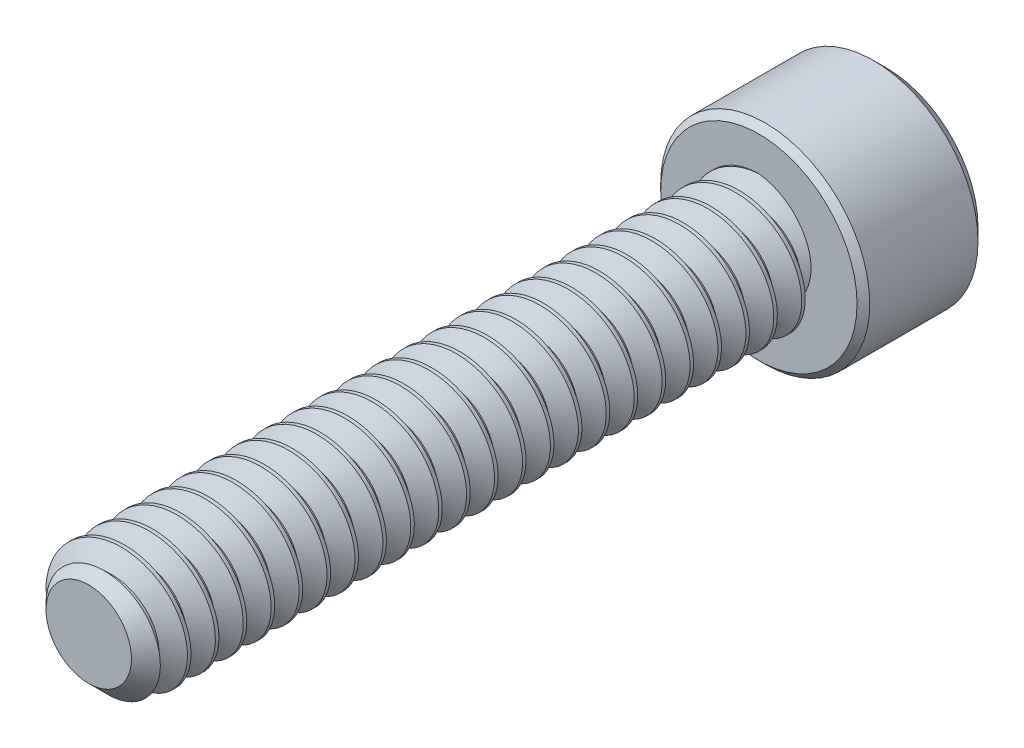
from build123d import *

# Parameters (mm, degrees)
SKETCH1_R          = 2.413
EXTRUDE1_DEPTH     = 25.4
CHAMFER3_SIZE      = 0.79375
CUT_SWEEP1_PITCH   = 1.058333333
SKETCH6_R          = 3.9624
EXTRUDE2_DEPTH     = 4.826
CUT_EXTRUDE1_DEPTH = 2.9765625
SKETCH8_R          = 2.291358881
CUT_EXTRUDE2_DEPTH = 0.4826
CUT_EXTRUDE2_DRAFT = -45
CHAMFER1_SIZE      = 0.4826
CHAMFER2_SIZE      = 0.2413


with BuildPart() as part:
    # Sketch1 → Extrude1 (new body)
    with BuildSketch(Plane.XY):
        Circle(SKETCH1_R)
    extrude(amount=-EXTRUDE1_DEPTH)

    # Chamfer3
    chamfer3_edges = [part.edges().sort_by_distance(p)[0] for p in [
        (-2.413, 0, 0),
    ]]
    chamfer(chamfer3_edges, length=CHAMFER3_SIZE)

    # Cut-Sweep1: the profile of Sketch3 profile screwed along a right-hand helix of 25 turns, 6 arcs to a turn; built about Z, then put on its axis
    cut_sweep1_z = Axis((0, 0, 0), (0, 0, 1))
    cut_sweep1_corners = [(2.4133, 0, -0.926214872), (1.725592336, 0, -0.529166667), (1.725592336, 0, -0.396875), (2.4133, 0, 0.000173205)]
    with BuildLine(mode=Mode.PRIVATE) as cut_sweep1_profile:
        Line(cut_sweep1_corners[0], cut_sweep1_corners[1])
        Line(cut_sweep1_corners[1], cut_sweep1_corners[2])
        Line(cut_sweep1_corners[2], cut_sweep1_corners[3])
        Line(cut_sweep1_corners[3], cut_sweep1_corners[0])
    cut_sweep1_cap = Face(cut_sweep1_profile.wire())
    cut_sweep1_turn_angles = [0, 30, 60, 90, 120, 150, 180, 210, 240, 270, 300, 330, 360]
    cut_sweep1_turn_weights = [1, 0.8660254037844387, 1, 0.8660254037844387, 1, 0.8660254037844387, 1, 0.8660254037844387, 1, 0.8660254037844387, 1, 0.8660254037844387, 1]
    cut_sweep1_turn_rails = [Edge.make_bspline([Vector(p[0], p[1], 0).rotate(cut_sweep1_z, cut_sweep1_turn_angles[k]) / cut_sweep1_turn_weights[k] + Vector(0, 0, p[2] + CUT_SWEEP1_PITCH * cut_sweep1_turn_angles[k] / 360) for k in range(13)], [0, 0, 0, 1, 1, 2, 2, 3, 3, 4, 4, 5, 5, 6, 6, 6], 2, cut_sweep1_turn_weights) for p in cut_sweep1_corners]
    cut_sweep1_turn_sides = [Face.make_surface_from_curves(cut_sweep1_turn_rails[p[0]], cut_sweep1_turn_rails[p[1]]) for p in [(0, 1), (1, 2), (2, 3), (3, 0)]]
    cut_sweep1 = Plane(origin=(0, 0, 0), x_dir=(0, 1, 0), z_dir=(0, 0, -1)) * Solid(Shell([*[p.moved(Location((0, 0, CUT_SWEEP1_PITCH * i))) for i in range(25) for p in cut_sweep1_turn_sides], cut_sweep1_cap, cut_sweep1_cap.rotate(cut_sweep1_z, 9000).moved(Location((0, 0, CUT_SWEEP1_PITCH * 9000 / 360)))]))
    add(cut_sweep1, mode=Mode.SUBTRACT)

    # Sketch6 → Extrude2 (add)
    with BuildSketch(Plane(origin=(0, 0, -25.4), x_dir=(-1, 0, 0), z_dir=(0, 0, -1))):
        Circle(SKETCH6_R)
    extrude(amount=EXTRUDE2_DEPTH)

    # Sketch7 → Cut-Extrude1 (cut)
    with BuildSketch(Plane(origin=(0, 0, -30.226), x_dir=(-1, 0, 0), z_dir=(0, 0, -1))):
        Polygon((0, 2.291358881), (-1.984375, 1.14567944), (-1.984375, -1.14567944), (0, -2.291358881), (1.984375, -1.14567944), (1.984375, 1.14567944), align=None)
    extrude(amount=-CUT_EXTRUDE1_DEPTH, mode=Mode.SUBTRACT)


with BuildPart() as cut_extrude2_tool:
    # Sketch8 → Cut-Extrude2 (with draft: the straight prism first)
    with BuildSketch(Plane(origin=(0, 0, -30.226), x_dir=(-1, 0, 0), z_dir=(0, 0, -1))):
        Circle(SKETCH8_R)
    extrude(amount=-CUT_EXTRUDE2_DEPTH)
    # Cut-Extrude2: the draft: its side faces are tilted about the plane it starts from
    cut_extrude2_sides = [cut_extrude2_tool.faces().sort_by_distance(p)[0] for p in [
        (2.291358881, 0, -29.9847),
    ]]
    draft(cut_extrude2_sides, Plane(origin=(0, 0, -30.226), x_dir=(-1, 0, 0), z_dir=(0, 0, -1)), CUT_EXTRUDE2_DRAFT)


with BuildPart() as part_1:
    add(part.part)

    # Cut-Extrude2: cut by cut_extrude2_tool
    add(cut_extrude2_tool.part, mode=Mode.SUBTRACT)

    # Chamfer1
    chamfer1_edges = [part_1.edges().sort_by_distance(p)[0] for p in [
        (3.9624, 0, -30.226),
    ]]
    chamfer(chamfer1_edges, length=CHAMFER1_SIZE)

    # Chamfer2
    chamfer2_edges = [part_1.edges().sort_by_distance(p)[0] for p in [
        (3.9624, 0, -25.4),
    ]]
    chamfer(chamfer2_edges, length=CHAMFER2_SIZE)


solid = part_1.part
